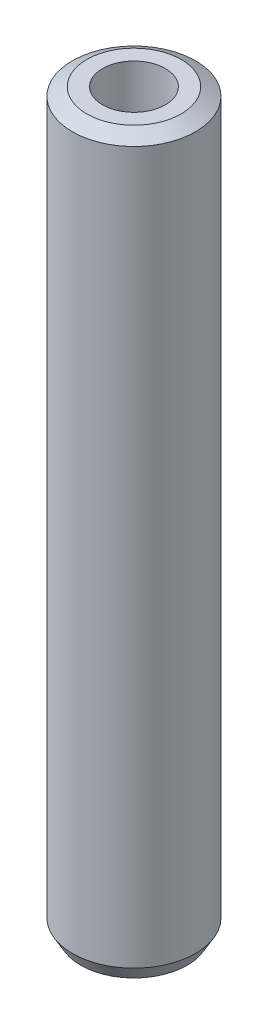
from build123d import *
from OCP.BRepFilletAPI import BRepFilletAPI_MakeChamfer

# Parameters (mm, degrees)
SKETCH1_R           = 30
BOSS_EXTRUDE1_DEPTH = 357.825130063
SKETCH2_R           = 15.315637508
CUT_EXTRUDE1_DEPTH  = 361.331546918
CHAMFER1_SIZE       = 4.042984515
CHAMFER1_SIZE2      = 7.002654593


with BuildPart() as part:
    # Sketch1 → Boss-Extrude1 (new body)
    with BuildSketch(Plane(origin=(0, 0, 0), x_dir=(1, 0, 0), z_dir=(0, 1, 0))):
        Circle(SKETCH1_R)
    extrude(amount=BOSS_EXTRUDE1_DEPTH)

    # Sketch2 → Cut-Extrude1 (cut, through all)
    with BuildSketch(Plane(origin=(0, 0, 0), x_dir=(1, 0, 0), z_dir=(0, 1, 0))):
        Circle(SKETCH2_R)
    extrude(amount=CUT_EXTRUDE1_DEPTH, mode=Mode.SUBTRACT)

    # Chamfer1: one chamfer whose edges measure the first distance from different faces: ONE call of the kernel's chamfer builder (chamfer() names one face for all edges)
    chamfer1_edges_1 = [part.edges().sort_by_distance(p)[0] for p in [
        (-30, 357.825130063, 0),
    ]]
    chamfer1_side_1 = [part.faces().sort_by_distance(p)[0] for p in [
        (-30, 178.912565031, 0),
    ]]
    chamfer1_edges_2 = [part.edges().sort_by_distance(p)[0] for p in [
        (-30, 0, 0),
    ]]
    chamfer1_side_2 = [part.faces().sort_by_distance(p)[0] for p in [
        (-29.151471863, 0, 0),
    ]]
    chamfer1 = BRepFilletAPI_MakeChamfer(part.part.solid().wrapped)
    for e in chamfer1_edges_1:
        chamfer1.Add(CHAMFER1_SIZE, CHAMFER1_SIZE2, e.wrapped, chamfer1_side_1[0].wrapped)  # the first distance lies on this face
    for e in chamfer1_edges_2:
        chamfer1.Add(CHAMFER1_SIZE, CHAMFER1_SIZE2, e.wrapped, chamfer1_side_2[0].wrapped)  # the first distance lies on this face
    add(Compound.cast(chamfer1.Shape()), mode=Mode.REPLACE)


solid = part.part
